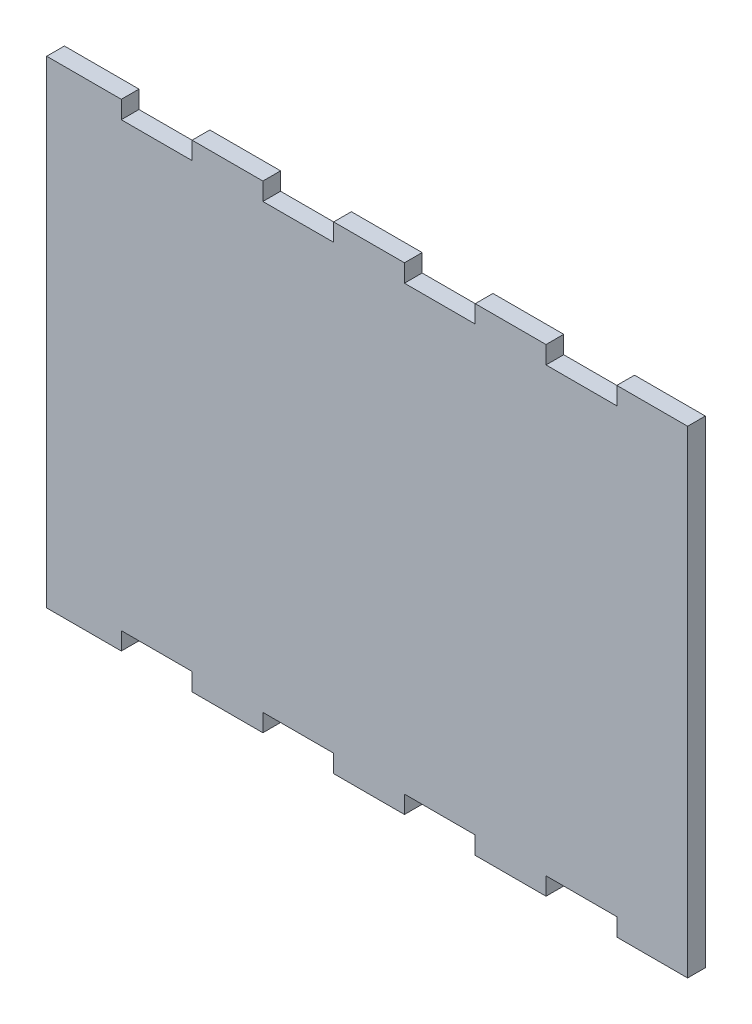
from build123d import *

# Parameters (mm, degrees)
SKETCH1_W           = 229.969358589
SKETCH1_H           = 171.45
BOSS_EXTRUDE1_DEPTH = 6.35
SKETCH2_W           = 25.4
SKETCH2_H           = 6.35
CUT_EXTRUDE1_DEPTH  = 6.35
LPATTERN1_COUNT     = 4
LPATTERN1_PITCH     = 50.8


with BuildPart() as part:
    # Sketch1 → Boss-Extrude1 (new body)
    with BuildSketch(Plane.XY):
        with Locations((-24.365205383, 69.85)):
            Rectangle(SKETCH1_W, SKETCH1_H)
    extrude(amount=BOSS_EXTRUDE1_DEPTH)

    # Sketch2 → Cut-Extrude1 (cut)
    with BuildSketch(Plane.XY.offset(6.35)):
        with Locations((-99.880526088, -12.7)):
            Rectangle(SKETCH2_W, SKETCH2_H)
        with Locations((-99.880526088, 152.4)):
            Rectangle(SKETCH2_W, SKETCH2_H)
    cut_extrude1 = extrude(amount=-CUT_EXTRUDE1_DEPTH, mode=Mode.SUBTRACT)

    # LPattern1: Cut-Extrude1 ×4
    with Locations(*[(i * LPATTERN1_PITCH, 0, 0) for i in range(1, LPATTERN1_COUNT)]):
        add(cut_extrude1, mode=Mode.SUBTRACT)


solid = part.part
